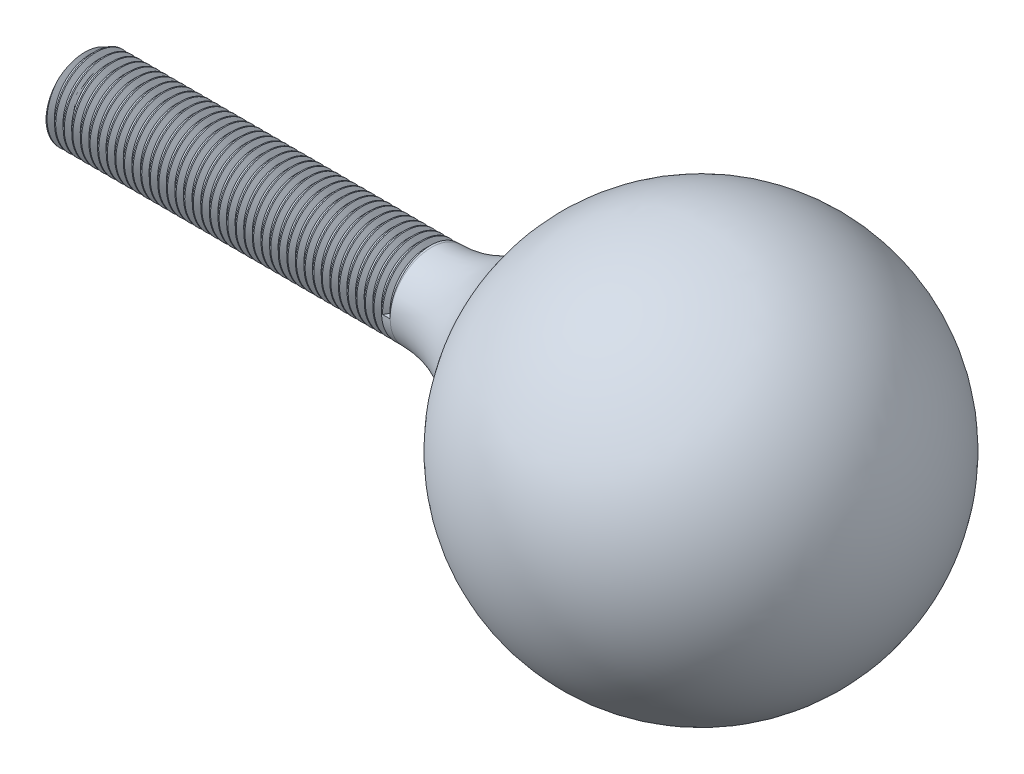
from build123d import *

# Parameters (mm, degrees)
THREAD1_PITCH = 1.25


with BuildPart() as part:
    # Sketch1 → Revolve2 (revolve)
    with BuildSketch(Plane.XY, mode=Mode.PRIVATE) as revolve2_sk:
        with BuildLine():
            Line((0, 0), (50, 0))
            Line((50, 0), (117.621195951, 0))
            ThreePointArc((117.621195951, 0), (96.598501926, 27.474753232), (64.58300857, 14.366591103))
            ThreePointArc((64.58300857, 14.366591103), (58.406306942, 8.240189153), (50, 6))
            Line((50, 6), (0, 6))
            Line((0, 6), (0, 0))
        make_face()
    revolve(revolve2_sk.sketch.rotate(Axis((0, 0, 0), (1, 0, 0)), 90), axis=Axis((0, 0, 0), (1, 0, 0)))

    # Thread1: arcs per turn and ends read off the stored shape
    # Thread1: the profile of Thread Profile1 profile screwed along a right-hand helix through 56 turns, 6 arcs to a turn; built about Z, then put on its axis
    thread1_z = Axis((0, 0, 0), (0, 0, 1))
    thread1_corners = [(6.0003, 0, -0.000173205), (6.0003, 0, 1.093923202), (5.323417656, 0, 0.703124998), (5.323417656, 0, 0.390624998)]
    with BuildLine(mode=Mode.PRIVATE) as thread1_profile:
        Line(thread1_corners[0], thread1_corners[1])
        Line(thread1_corners[1], thread1_corners[2])
        Line(thread1_corners[2], thread1_corners[3])
        Line(thread1_corners[3], thread1_corners[0])
    thread1_cap = Face(thread1_profile.wire())
    thread1_turn_angles = [0, 30, 60, 90, 120, 150, 180, 210, 240, 270, 300, 330, 360]
    thread1_turn_weights = [1, 0.8660254037844387, 1, 0.8660254037844387, 1, 0.8660254037844387, 1, 0.8660254037844387, 1, 0.8660254037844387, 1, 0.8660254037844387, 1]
    thread1_turn_rails = [Edge.make_bspline([Vector(p[0], p[1], 0).rotate(thread1_z, thread1_turn_angles[k]) / thread1_turn_weights[k] + Vector(0, 0, p[2] + THREAD1_PITCH * thread1_turn_angles[k] / 360) for k in range(13)], [0, 0, 0, 1, 1, 2, 2, 3, 3, 4, 4, 5, 5, 6, 6, 6], 2, thread1_turn_weights) for p in thread1_corners]
    thread1_turn_sides = [Face.make_surface_from_curves(thread1_turn_rails[p[0]], thread1_turn_rails[p[1]]) for p in [(0, 1), (1, 2), (2, 3), (3, 0)]]
    thread1 = Plane(origin=(50, 0, 0), x_dir=(0, 0, 1), z_dir=(-1, 0, 0)) * Solid(Shell([*[p.moved(Location((0, 0, THREAD1_PITCH * i))) for i in range(56) for p in thread1_turn_sides], thread1_cap, thread1_cap.rotate(thread1_z, 20160).moved(Location((0, 0, THREAD1_PITCH * 20160 / 360)))]))
    add(thread1, mode=Mode.SUBTRACT)


solid = part.part
